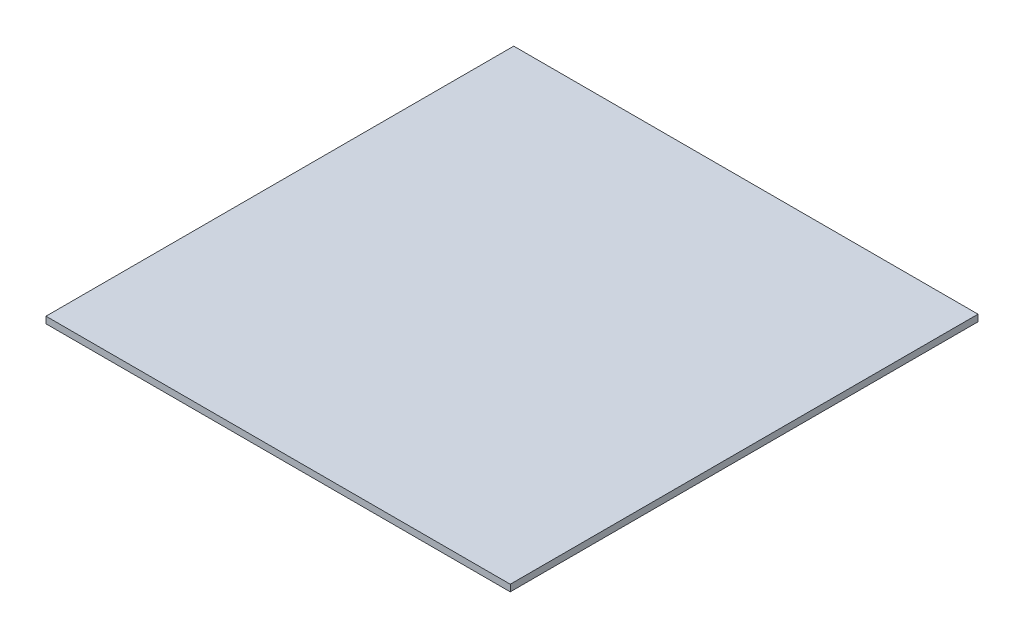
from build123d import *

# Parameters (mm, degrees)
BOSS_EXTRUDE1_DEPTH = 302.625
SKETCH3_W           = 700
SKETCH3_H           = 10
BOSS_EXTRUDE2_DEPTH = 50
SKETCH4_W           = 700
SKETCH4_H           = 10
BOSS_EXTRUDE3_DEPTH = 50


with BuildPart() as part:
    # Sketch2 → Boss-Extrude1 (new, symmetric)
    with BuildSketch(Plane.XY):
        Polygon((0, 35), (-350, 35), (-350, 25), (-225, 25), (-225, 0), (0, 0), align=None)
    boss_extrude1 = extrude(amount=BOSS_EXTRUDE1_DEPTH, both=True)

    # Mirror1: Boss-Extrude1 across plane
    add(boss_extrude1.mirror(Plane(origin=(0, 35, 302.625), x_dir=(0, 0, 1), z_dir=(-1, 0, 0))))

    # Sketch3 → Boss-Extrude2 (add)
    with BuildSketch(Plane.XY.offset(302.625)):
        with Locations((0, 30)):
            Rectangle(SKETCH3_W, SKETCH3_H)
    extrude(amount=BOSS_EXTRUDE2_DEPTH)

    # Sketch4 → Boss-Extrude3 (add)
    with BuildSketch(Plane(origin=(0, 0, -302.625), x_dir=(-1, 0, 0), z_dir=(0, 0, -1))):
        with Locations((0, 30)):
            Rectangle(SKETCH4_W, SKETCH4_H)
    extrude(amount=BOSS_EXTRUDE3_DEPTH)


solid = part.part
